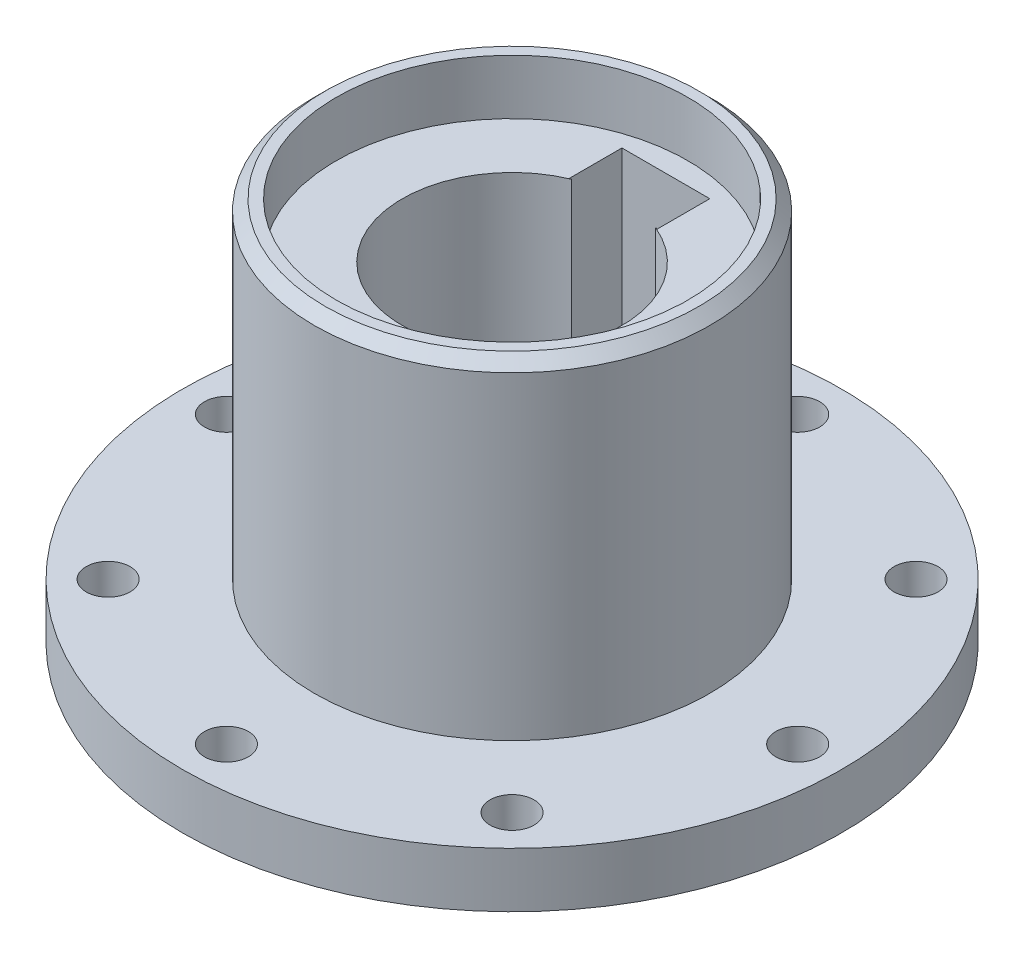
from build123d import *

# Parameters (mm, degrees)
SKETCH_2_R          = 16
CUT_EXTRUDE_1_DEPTH = 5
SKETCH_3_W          = 8
SKETCH_3_H          = 4.763902078
CUT_EXTRUDE_2_DEPTH = 47
SKETCH_4_R          = 2
CUT_EXTRUDE_3_DEPTH = 47


with BuildPart() as part:
    # Эскиз1 → Повернуть1 (revolve)
    with BuildSketch(Plane.XY):
        Polygon((-10, -11.743736627), (-20.4, -11.743736627), (-22, -10.143736627), (-22, -6.743736627), (-30, -6.743736627), (-30, -1.743736627), (-18, -1.743736627), (-18, 27.256263373), (-17, 28.256263373), (-10, 28.256263373), align=None)
    revolve(axis=Axis((0, 48.654121305, 0), (0, -1, 0)))

    # Эскиз2 → Вырез-Вытянуть1 (cut)
    with BuildSketch(Plane(origin=(0, 28.256263373, 0), x_dir=(1, 0, 0), z_dir=(0, 1, 0))):
        Circle(SKETCH_2_R)
    extrude(amount=-CUT_EXTRUDE_1_DEPTH, mode=Mode.SUBTRACT)

    # Эскиз3 → Вырез-Вытянуть2 (cut)
    with BuildSketch(Plane(origin=(0, 23.256263373, 0), x_dir=(1, 0, 0), z_dir=(0, 1, 0))):
        with Locations((0, 11.618048961)):
            Rectangle(SKETCH_3_W, SKETCH_3_H)
    extrude(amount=-CUT_EXTRUDE_2_DEPTH, mode=Mode.SUBTRACT)

    # Эскиз4 → Вырез-Вытянуть3 (cut)
    with BuildSketch(Plane.XZ.offset(6.743736627)):
        with Locations((0, 26)):
            Circle(SKETCH_4_R)
        with Locations((18.384776311, 18.384776311)):
            Circle(SKETCH_4_R)
        with Locations((26, 0)):
            Circle(SKETCH_4_R)
        with Locations((18.384776311, -18.384776311)):
            Circle(SKETCH_4_R)
        with Locations((0, -26)):
            Circle(SKETCH_4_R)
        with Locations((-18.384776311, -18.384776311)):
            Circle(SKETCH_4_R)
        with Locations((-26, 0)):
            Circle(SKETCH_4_R)
        with Locations((-18.384776311, 18.384776311)):
            Circle(SKETCH_4_R)
    extrude(amount=-CUT_EXTRUDE_3_DEPTH, mode=Mode.SUBTRACT)


solid = part.part
